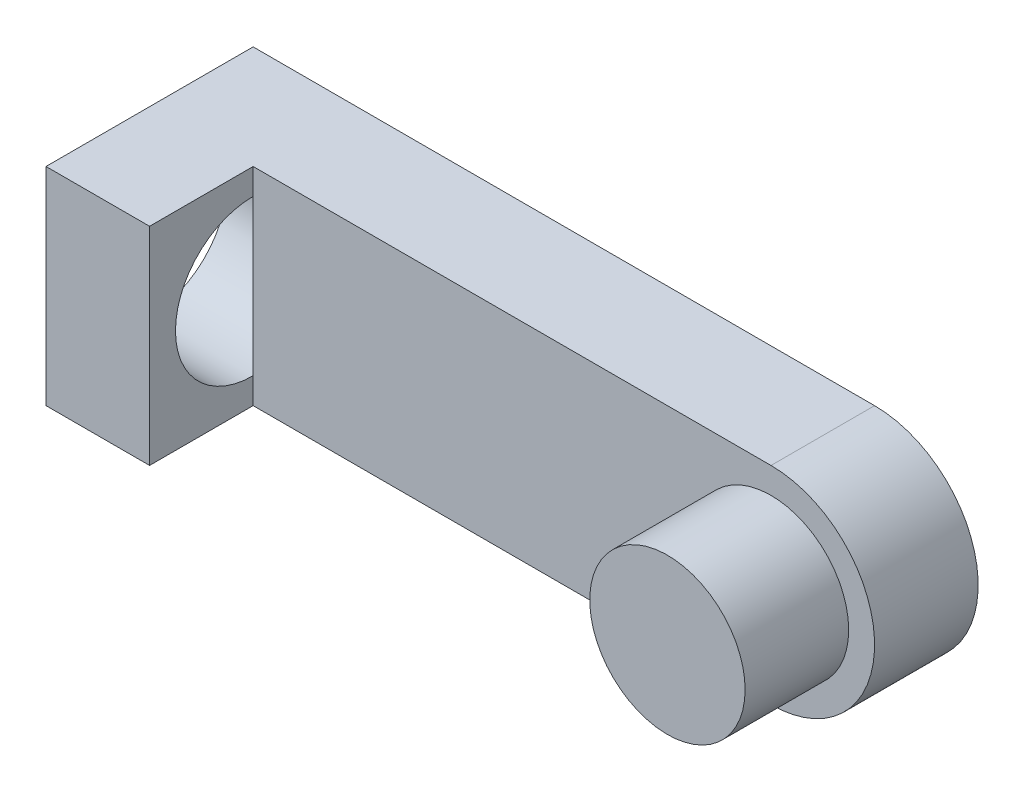
from build123d import *

# Parameters (mm, degrees)
SKETCH1_R           = 25.4
SKETCH1_W           = 152.4
SKETCH1_H           = 50.8
BOSS_EXTRUDE1_DEPTH = 25.4
SKETCH3_R           = 19.05
BOSS_EXTRUDE2_DEPTH = 25.4
SKETCH4_W           = 25.4
SKETCH4_H           = 50.8
BOSS_EXTRUDE3_DEPTH = 25.4
SKETCH5_R           = 19.05
CUT_EXTRUDE1_DEPTH  = 25.4


with BuildPart() as part:
    # Sketch1 → Boss-Extrude1 (new body)
    with BuildSketch(Plane.XY):
        with Locations((76.2, 0)):
            Circle(SKETCH1_R)
        Rectangle(SKETCH1_W, SKETCH1_H)
    extrude(amount=BOSS_EXTRUDE1_DEPTH)

    # Sketch3 → Boss-Extrude2 (add)
    with BuildSketch(Plane.XY.offset(25.4)):
        with Locations((76.2, 0)):
            Circle(SKETCH3_R)
    extrude(amount=BOSS_EXTRUDE2_DEPTH)

    # Sketch4 → Boss-Extrude3 (add)
    with BuildSketch(Plane.XY.offset(25.4)):
        with Locations((-63.5, 0)):
            Rectangle(SKETCH4_W, SKETCH4_H)
    extrude(amount=BOSS_EXTRUDE3_DEPTH)

    # Sketch5 → Cut-Extrude1 (cut)
    with BuildSketch(Plane.ZY.offset(76.2)):
        with Locations((25.4, 0)):
            Circle(SKETCH5_R)
    extrude(amount=-CUT_EXTRUDE1_DEPTH, mode=Mode.SUBTRACT)


solid = part.part
